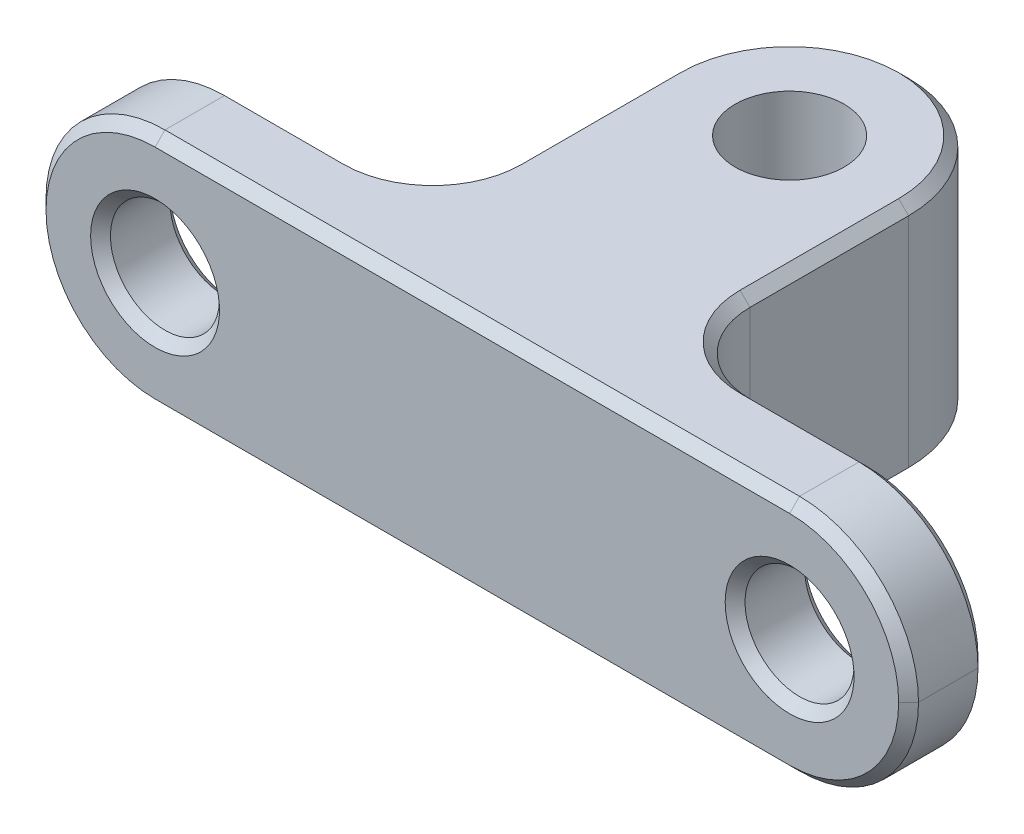
from build123d import *

# Parameters (mm, degrees)
SKETCH1_R               = 2.1828125
BOSS_EXTRUDE1_DEPTH     = 9.525
CUT_EXTRUDE1_DEPTH      = 25.490757185
CUT_EXTRUDE1_DEPTH_BACK = 25.490757185
SKETCH2_R               = 2.1828125
FILLET1_R               = 4.7625
FILLET2_R               = 3.175
CHAMFER1_SIZE           = 0.396875


with BuildPart() as part:
    # Sketch1 → Boss-Extrude1 (new body)
    with BuildSketch(Plane(origin=(0, 0, 0), x_dir=(1, 0, 0), z_dir=(0, 1, 0))):
        with BuildLine():
            Line((-4.7625, 0), (-4.7625, -9.525))
            Line((-4.7625, -9.525), (-17.4625, -9.525))
            Line((-17.4625, -9.525), (-17.4625, -12.7))
            Line((-17.4625, -12.7), (17.4625, -12.7))
            Line((17.4625, -12.7), (17.4625, -9.525))
            Line((17.4625, -9.525), (4.7625, -9.525))
            Line((4.7625, -9.525), (4.7625, 0))
            ThreePointArc((4.7625, 0), (0, 4.7625), (-4.7625, 0))
        make_face()
        with Locations(Location((0, 0, 0), (0, 0, 90))):
            Circle(SKETCH1_R, mode=Mode.SUBTRACT)
    extrude(amount=BOSS_EXTRUDE1_DEPTH)

    # Sketch2 → Cut-Extrude1 (cut, two sides: drawn at the far end of the back side and taken through both)
    with BuildSketch(Plane(origin=(0, 0, 9.525), x_dir=(-1, 0, 0), z_dir=(0, 0, -1)).offset(-CUT_EXTRUDE1_DEPTH_BACK)):
        with Locations((-12.7, 4.7625)):
            Circle(SKETCH2_R)
        with Locations((12.7, 4.7625)):
            Circle(SKETCH2_R)
    extrude(amount=CUT_EXTRUDE1_DEPTH + CUT_EXTRUDE1_DEPTH_BACK, mode=Mode.SUBTRACT)

    # Fillet1
    fillet1_edges = [part.edges().sort_by_distance(p)[0] for p in [
        (17.4625, 9.525, 11.1125),
        (17.4625, 0, 11.1125),
        (-17.4625, 9.525, 11.1125),
        (-17.4625, 0, 11.1125),
    ]]
    fillet(fillet1_edges, radius=FILLET1_R - 0.0001)  # a hair under: the kernel refuses the full size

    # Fillet2
    fillet2_edges = [part.edges().sort_by_distance(p)[0] for p in [
        (4.7625, 4.7625, 9.525),
        (-4.7625, 4.7625, 9.525),
    ]]
    fillet(fillet2_edges, radius=FILLET2_R)

    # Chamfer1
    chamfer1_edges = [part.edges().sort_by_distance(p)[0] for p in [
        (-4.7625, 0, 3.175),
        (0, 0, -4.7625),
        (0, 0, 2.1828125),
        (14.8828125, 4.7625, 12.7),
        (14.8828125, 4.7625, 9.525),
        (-10.5171875, 4.7625, 12.7),
        (-10.5171875, 4.7625, 9.525),
        (0, 9.525, 12.7),
        (10.3188, 9.525, 9.525),
        (10.3188, 0, 9.525),
        (16.067625335, 1.394874665, 9.525),
        (16.067625335, 8.130125335, 9.525),
        (0, 0, 12.7),
        (-16.067625335, 1.394874665, 12.7),
        (-16.067625335, 8.130125335, 12.7),
        (16.067625335, 1.394874665, 12.7),
        (16.067625335, 8.130125335, 12.7),
        (-16.067625335, 1.394874665, 9.525),
        (-16.067625335, 8.130125335, 9.525),
        (0, 9.525, -4.7625),
        (4.7625, 0, 3.175),
        (4.7625, 9.525, 3.175),
        (-10.3188, 9.525, 9.525),
        (-10.3188, 0, 9.525),
        (5.69243597, 0, 8.59506403),
        (5.69243597, 9.525, 8.59506403),
        (-5.69243597, 0, 8.59506403),
        (-5.69243597, 9.525, 8.59506403),
        (-4.7625, 9.525, 3.175),
    ]]
    chamfer(chamfer1_edges, length=CHAMFER1_SIZE)


solid = part.part
